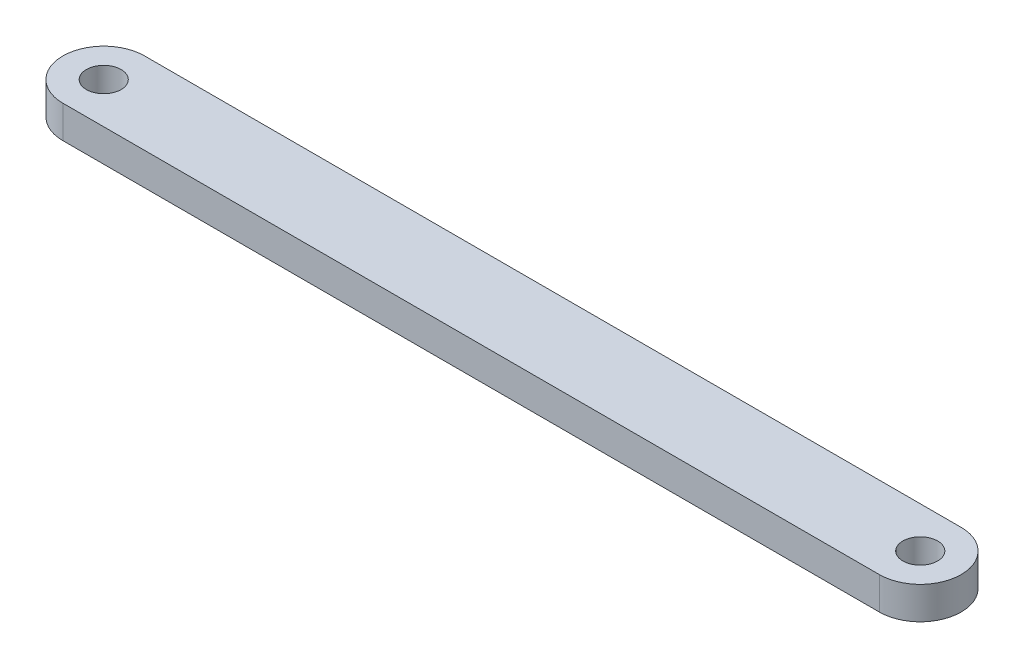
from build123d import *

# Parameters (mm, degrees)
SKETCH1_R           = 1.7
BOSS_EXTRUDE1_DEPTH = 3.175


with BuildPart() as part:
    # Sketch1 → Boss-Extrude1 (new body)
    with BuildSketch(Plane(origin=(0, 0, 0), x_dir=(1, 0, 0), z_dir=(0, 1, 0))):
        with BuildLine():
            Line((40.018335965, 4.000091093), (-39.839960243, 4.000091093))
            ThreePointArc((-39.839960243, 4.000091093), (-43.840051334, 2e-09), (-39.839960243, -4.000091089))
            Line((-39.839960243, -4.000091089), (40.018335965, -4.000091089))
            ThreePointArc((40.018335965, -4.000091089), (44.018427056, 2e-09), (40.018335965, 4.000091093))
        make_face()
        with Locations((-39.839960243, 2e-09)):
            Circle(SKETCH1_R, mode=Mode.SUBTRACT)
        with Locations((40.018335965, 2e-09)):
            Circle(SKETCH1_R, mode=Mode.SUBTRACT)
    extrude(amount=BOSS_EXTRUDE1_DEPTH)


solid = part.part
